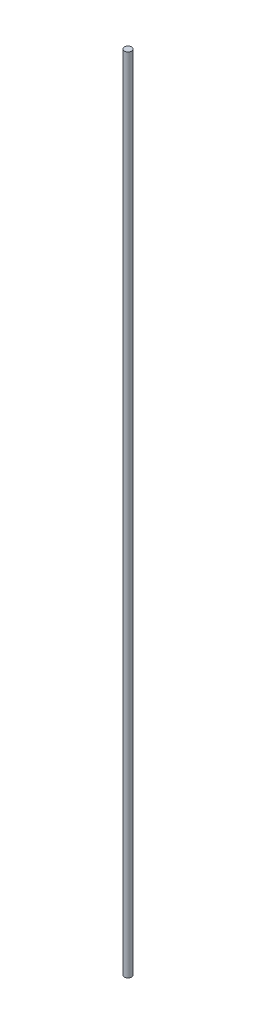
from build123d import *

# Parameters (mm, degrees)
SKETCH_2_W = 2.5
SKETCH_2_H = 550


with BuildPart() as part:
    # Эскиз2 → Повернуть1 (revolve)
    with BuildSketch(Plane.XY):
        with Locations((-1.25, 0)):
            Rectangle(SKETCH_2_W, SKETCH_2_H)
    revolve(axis=Axis((-2.5, 275, 0), (0, -1, 0)))


solid = part.part
